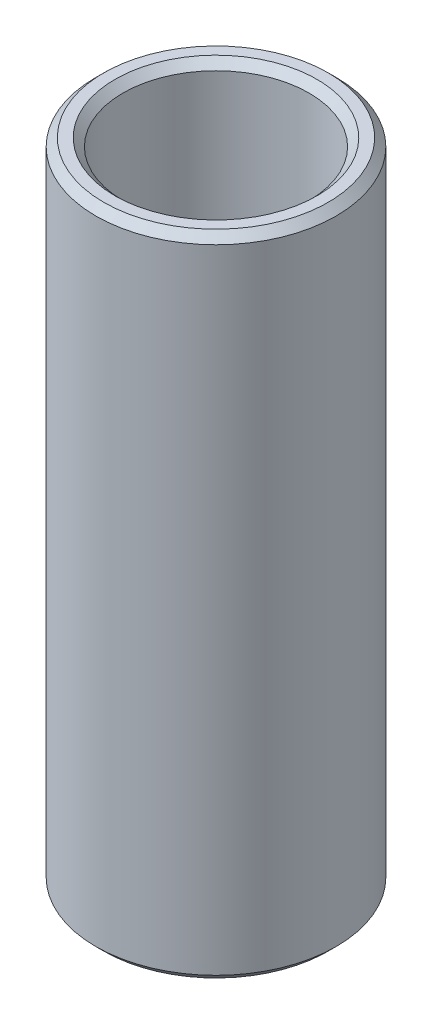
from build123d import *

# Parameters (mm, degrees)
SKETCH1_R           = 50
BOSS_EXTRUDE1_DEPTH = 269.960897826
SKETCH2_R           = 38.738450607
CUT_EXTRUDE1_DEPTH  = 280.067888434
CHAMFER1_SIZE       = 3.292696884


with BuildPart() as part:
    # Sketch1 → Boss-Extrude1 (new body)
    with BuildSketch(Plane(origin=(0, 0, 0), x_dir=(1, 0, 0), z_dir=(0, 1, 0))):
        Circle(SKETCH1_R)
    extrude(amount=BOSS_EXTRUDE1_DEPTH)

    # Sketch2 → Cut-Extrude1 (cut, through all)
    with BuildSketch(Plane(origin=(0, 0, 0), x_dir=(1, 0, 0), z_dir=(0, 1, 0))):
        Circle(SKETCH2_R)
    extrude(amount=CUT_EXTRUDE1_DEPTH, mode=Mode.SUBTRACT)

    # Chamfer1
    chamfer1_edges = [part.edges().sort_by_distance(p)[0] for p in [
        (-38.738450607, 269.960897826, 0),
        (-38.738450607, 0, 0),
        (-50, 0, 0),
        (-50, 269.960897826, 0),
    ]]
    chamfer(chamfer1_edges, length=CHAMFER1_SIZE)


solid = part.part
